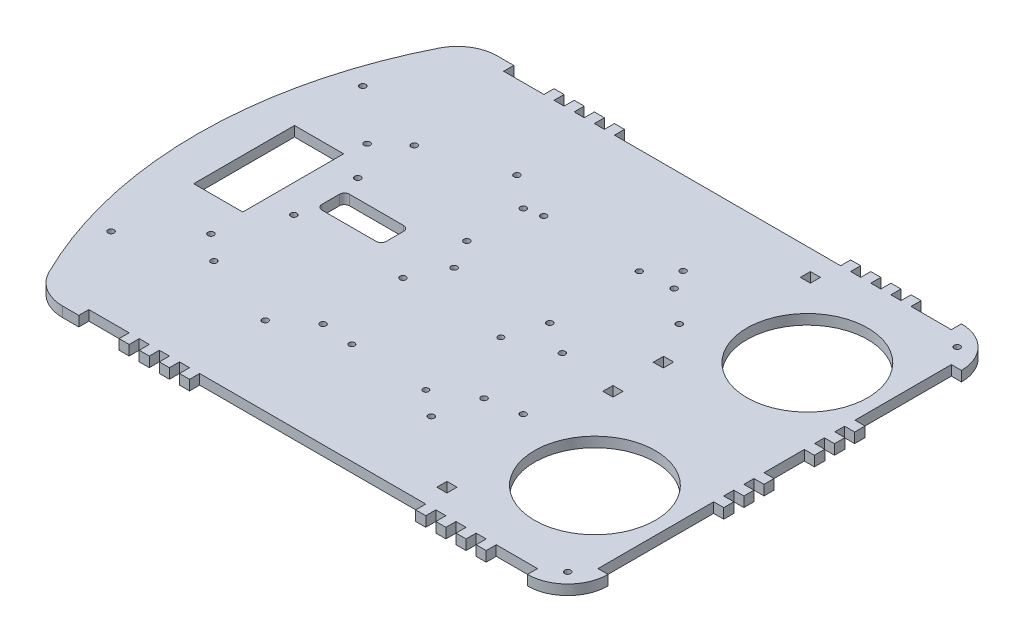
from build123d import *

# Parameters (mm, degrees)
MAIN_BASE_SKETCH_R   = 1.905
MAIN_BASE_SKETCH_R_2 = 1.796
MAIN_BASE_SKETCH_R_3 = 38.1
MAIN_BASE_SKETCH_W   = 6.302603838
MAIN_BASE_SKETCH_H   = 6.555527471
MAIN_BASE_SKETCH_W_2 = 6.35
MAIN_BASE_SKETCH_H_2 = 6.35
MAIN_BASE_SKETCH_W_3 = 30.959086934
MAIN_BASE_SKETCH_H_3 = 63.59667858
MAIN_BASE_DEPTH      = 6.35


with BuildPart() as part:
    # main_base_sketch → main_base (new body)
    with BuildSketch(Plane(origin=(0, 0, 0), x_dir=(1, 0, 0), z_dir=(0, 1, 0))):
        with BuildLine():
            Line((-94.961375831, 124.478458264), (-69.561375831, 124.478458264))
            Line((-69.561375831, 124.478458264), (-69.561375831, 130.828458264))
            Line((-69.561375831, 130.828458264), (-63.211375831, 130.828458264))
            Line((-63.211375831, 130.828458264), (-63.211375831, 124.478458264))
            Line((-63.211375831, 124.478458264), (-56.861375831, 124.478458264))
            Line((-56.861375831, 124.478458264), (-56.861375831, 130.828458264))
            Line((-56.861375831, 130.828458264), (-50.511375831, 130.828458264))
            Line((-50.511375831, 130.828458264), (-50.511375831, 124.478458264))
            Line((-50.511375831, 124.478458264), (-44.161375831, 124.478458264))
            Line((-44.161375831, 124.478458264), (-44.161375831, 130.828458264))
            Line((-44.161375831, 130.828458264), (-37.811375831, 130.828458264))
            Line((-37.811375831, 130.828458264), (-37.811375831, 124.478458264))
            Line((-37.811375831, 124.478458264), (-31.461375831, 124.478458264))
            Line((-31.461375831, 124.478458264), (-31.461375831, 130.828458264))
            Line((-31.461375831, 130.828458264), (-25.111375831, 130.828458264))
            Line((-25.111375831, 130.828458264), (-25.111375831, 124.478458264))
            Line((-25.111375831, 124.478458264), (117.475, 124.478458264))
            Line((117.475, 124.478458264), (117.475, 130.828458264))
            Line((117.475, 130.828458264), (123.825, 130.828458264))
            Line((123.825, 130.828458264), (123.825, 124.478458264))
            Line((123.825, 124.478458264), (130.175, 124.478458264))
            Line((130.175, 124.478458264), (130.175, 130.828458264))
            Line((130.175, 130.828458264), (136.525, 130.828458264))
            Line((136.525, 130.828458264), (136.525, 124.478458264))
            Line((136.525, 124.478458264), (142.875, 124.478458264))
            Line((142.875, 124.478458264), (142.875, 130.828458264))
            Line((142.875, 130.828458264), (149.225, 130.828458264))
            Line((149.225, 130.828458264), (149.225, 124.478458264))
            Line((149.225, 124.478458264), (155.575, 124.478458264))
            Line((155.575, 124.478458264), (155.575, 130.828458264))
            Line((155.575, 130.828458264), (161.925, 130.828458264))
            Line((161.925, 130.828458264), (161.925, 124.478458264))
            Line((161.925, 124.478458264), (187.325, 124.478458264))
            Line((187.325, 124.478458264), (187.325, 130.828458264))
            ThreePointArc((187.325, 130.828458264), (205.285512242, 123.388970506), (212.725, 105.428458264))
            Line((212.725, 105.428458264), (206.375, 105.428458264))
            Line((206.375, 105.428458264), (206.375, 44.655527471))
            Line((206.375, 44.655527471), (212.725, 44.655527471))
            Line((212.725, 44.655527471), (212.725, 38.1))
            Line((212.725, 38.1), (206.375, 38.1))
            Line((206.375, 38.1), (206.375, 31.955527471))
            Line((206.375, 31.955527471), (212.725, 31.955527471))
            Line((212.725, 31.955527471), (212.725, 25.4))
            Line((212.725, 25.4), (206.375, 25.4))
            Line((206.375, 25.4), (206.375, 24.179190074))
            Line((206.375, 24.179190074), (206.375, 19.255527471))
            Line((206.375, 19.255527471), (212.725, 19.255527471))
            Line((212.725, 19.255527471), (212.725, 12.7))
            Line((212.725, 12.7), (206.375, 12.7))
            Line((206.375, 12.7), (206.375, -12.7))
            Line((206.375, -12.7), (212.725, -12.7))
            Line((212.725, -12.7), (212.725, -19.05))
            Line((212.725, -19.05), (206.375, -19.05))
            Line((206.375, -19.05), (206.375, -25.4))
            Line((206.375, -25.4), (212.725, -25.4))
            Line((212.725, -25.4), (212.725, -31.75))
            Line((212.725, -31.75), (206.375, -31.75))
            Line((206.375, -31.75), (206.375, -38.1))
            Line((206.375, -38.1), (212.725, -38.1))
            Line((212.725, -38.1), (212.725, -44.45))
            Line((212.725, -44.45), (206.375, -44.45))
            Line((206.375, -44.45), (206.375, -117.410242597))
            Line((206.375, -117.410242597), (212.725, -117.410242597))
            ThreePointArc((212.725, -117.410242597), (205.285512242, -135.370754839), (187.325, -142.810242597))
            Line((187.325, -142.810242597), (187.325, -136.460242597))
            Line((187.325, -136.460242597), (161.284730748, -136.460242597))
            Line((161.284730748, -136.460242597), (161.284730748, -142.810242597))
            Line((161.284730748, -142.810242597), (154.934730748, -142.810242597))
            Line((154.934730748, -142.810242597), (154.934730748, -136.460242597))
            Line((154.934730748, -136.460242597), (148.584730748, -136.460242597))
            Line((148.584730748, -136.460242597), (148.584730748, -142.810242597))
            Line((148.584730748, -142.810242597), (142.234730748, -142.810242597))
            Line((142.234730748, -142.810242597), (142.234730748, -136.460242597))
            Line((142.234730748, -136.460242597), (135.884730748, -136.460242597))
            Line((135.884730748, -136.460242597), (135.884730748, -142.810242597))
            Line((135.884730748, -142.810242597), (129.534730748, -142.810242597))
            Line((129.534730748, -142.810242597), (129.534730748, -136.460242597))
            Line((129.534730748, -136.460242597), (123.184730748, -136.460242597))
            Line((123.184730748, -136.460242597), (123.184730748, -142.810242597))
            Line((123.184730748, -142.810242597), (116.834730748, -142.810242597))
            Line((116.834730748, -142.810242597), (116.834730748, -136.460242597))
            Line((116.834730748, -136.460242597), (-25.751645083, -136.460242597))
            Line((-25.751645083, -136.460242597), (-25.751645083, -142.810242597))
            Line((-25.751645083, -142.810242597), (-32.101645083, -142.810242597))
            Line((-32.101645083, -142.810242597), (-32.101645083, -136.460242597))
            Line((-32.101645083, -136.460242597), (-38.451645083, -136.460242597))
            Line((-38.451645083, -136.460242597), (-38.451645083, -142.810242597))
            Line((-38.451645083, -142.810242597), (-44.801645083, -142.810242597))
            Line((-44.801645083, -142.810242597), (-44.801645083, -136.460242597))
            Line((-44.801645083, -136.460242597), (-51.151645083, -136.460242597))
            Line((-51.151645083, -136.460242597), (-51.151645083, -142.810242597))
            Line((-51.151645083, -142.810242597), (-57.501645083, -142.810242597))
            Line((-57.501645083, -142.810242597), (-57.501645083, -136.460242597))
            Line((-57.501645083, -136.460242597), (-63.851645083, -136.460242597))
            Line((-63.851645083, -136.460242597), (-63.851645083, -142.810242597))
            Line((-63.851645083, -142.810242597), (-70.201645083, -142.810242597))
            Line((-70.201645083, -142.810242597), (-70.201645083, -136.460242597))
            Line((-70.201645083, -136.460242597), (-95.601645083, -136.460242597))
            Line((-95.601645083, -136.460242597), (-95.601645083, -142.810242597))
            Line((-95.601645083, -142.810242597), (-105.798207048, -142.810242597))
            ThreePointArc((-105.798207048, -142.810242597), (-119.167015715, -139.007347839), (-128.532661201, -128.737404395))
            ThreePointArc((-128.532661201, -128.737404395), (-157.286213724, -5.861503432), (-127.918775374, 116.869125935))
            ThreePointArc((-127.918775374, 116.869125935), (-118.556014486, 127.058910858), (-105.241228699, 130.828458264))
            Line((-105.241228699, 130.828458264), (-94.961375831, 130.828458264))
            Line((-94.961375831, 130.828458264), (-94.961375831, 124.478458264))
        make_face()
        with Locations((-82.6643, 55.745700743)):
            Circle(MAIN_BASE_SKETCH_R, mode=Mode.SUBTRACT)
        with Locations((-13.8303, 55.745700743)):
            Circle(MAIN_BASE_SKETCH_R, mode=Mode.SUBTRACT)
        with Locations((-3.2843, 57.993600743)):
            Circle(MAIN_BASE_SKETCH_R, mode=Mode.SUBTRACT)
        with Locations((-13.8303, 20.1549)):
            Circle(MAIN_BASE_SKETCH_R, mode=Mode.SUBTRACT)
        with Locations((-3.2843, 1.529400743)):
            Circle(MAIN_BASE_SKETCH_R, mode=Mode.SUBTRACT)
        with Locations((-82.6643, 20.1549)):
            Circle(MAIN_BASE_SKETCH_R, mode=Mode.SUBTRACT)
        with Locations((-82.6643, -20.1549)):
            Circle(MAIN_BASE_SKETCH_R, mode=Mode.SUBTRACT)
        with Locations((-13.8303, -20.1549)):
            Circle(MAIN_BASE_SKETCH_R, mode=Mode.SUBTRACT)
        with Locations((-82.6643, -70.568499257)):
            Circle(MAIN_BASE_SKETCH_R, mode=Mode.SUBTRACT)
        with Locations((-13.8303, -70.568499257)):
            Circle(MAIN_BASE_SKETCH_R, mode=Mode.SUBTRACT)
        with Locations((6.29, -72.547599257)):
            Circle(MAIN_BASE_SKETCH_R_2, mode=Mode.SUBTRACT)
        with Locations((54.55, -74.135099257)):
            Circle(MAIN_BASE_SKETCH_R_2, mode=Mode.SUBTRACT)
        with Locations((49.47, -21.747599257)):
            Circle(MAIN_BASE_SKETCH_R_2, mode=Mode.SUBTRACT)
        with Locations((57.0407, 1.529400743)):
            Circle(MAIN_BASE_SKETCH_R, mode=Mode.SUBTRACT)
        with Locations((57.0407, 57.993600743)):
            Circle(MAIN_BASE_SKETCH_R, mode=Mode.SUBTRACT)
        with Locations((-98.425, 41.822400743)):
            Circle(MAIN_BASE_SKETCH_R, mode=Mode.SUBTRACT)
        with Locations((-34.0871, 71.963600743)):
            Circle(MAIN_BASE_SKETCH_R, mode=Mode.SUBTRACT)
        with Locations((70.6863, 71.963600743)):
            Circle(MAIN_BASE_SKETCH_R, mode=Mode.SUBTRACT)
        with Locations((98.425, 41.822400743)):
            Circle(MAIN_BASE_SKETCH_R, mode=Mode.SUBTRACT)
        with Locations((98.425, -56.645199257)):
            Circle(MAIN_BASE_SKETCH_R, mode=Mode.SUBTRACT)
        with Locations((70.6863, -86.786399257)):
            Circle(MAIN_BASE_SKETCH_R, mode=Mode.SUBTRACT)
        with Locations((-34.0871, -86.786399257)):
            Circle(MAIN_BASE_SKETCH_R, mode=Mode.SUBTRACT)
        with Locations((-98.425, -56.645199257)):
            Circle(MAIN_BASE_SKETCH_R, mode=Mode.SUBTRACT)
        with Locations((77.47, -60.325)):
            Circle(MAIN_BASE_SKETCH_R, mode=Mode.SUBTRACT)
        with Locations((77.47, 59.53125)):
            Circle(MAIN_BASE_SKETCH_R, mode=Mode.SUBTRACT)
        with Locations((77.47, -10.95375)):
            Circle(MAIN_BASE_SKETCH_R, mode=Mode.SUBTRACT)
        with Locations((160.02, 60.978458264)):
            Circle(MAIN_BASE_SKETCH_R_3, mode=Mode.SUBTRACT)
        with Locations((160.02, -72.960242597)):
            Circle(MAIN_BASE_SKETCH_R_3, mode=Mode.SUBTRACT)
        with Locations((-131.296368682, 71.963600743)):
            Circle(MAIN_BASE_SKETCH_R, mode=Mode.SUBTRACT)
        with Locations((-131.296368682, -86.786399257)):
            Circle(MAIN_BASE_SKETCH_R, mode=Mode.SUBTRACT)
        with Locations((198.617679728, 116.869125935)):
            Circle(MAIN_BASE_SKETCH_R, mode=Mode.SUBTRACT)
        with Locations((198.617679728, -128.737404395)):
            Circle(MAIN_BASE_SKETCH_R, mode=Mode.SUBTRACT)
        with Locations((114.276301919, 15.977763736)):
            Rectangle(MAIN_BASE_SKETCH_W, MAIN_BASE_SKETCH_H, mode=Mode.SUBTRACT)
        with BuildLine():
            Line((-42.259046148, -8.681650359), (-76.408932816, -8.681650359))
            ThreePointArc((-76.408932816, -8.681650359), (-78.653996846, -7.751714389), (-79.583932816, -5.506650359))
            Line((-79.583932816, -5.506650359), (-79.583932816, 5.506650359))
            ThreePointArc((-79.583932816, 5.506650359), (-78.653996846, 7.751714389), (-76.408932816, 8.681650359))
            Line((-76.408932816, 8.681650359), (-42.259046148, 8.681650359))
            ThreePointArc((-42.259046148, 8.681650359), (-40.013982118, 7.751714389), (-39.084046148, 5.506650359))
            Line((-39.084046148, 5.506650359), (-39.084046148, -5.506650359))
            ThreePointArc((-39.084046148, -5.506650359), (-40.013982118, -7.751714389), (-42.259046148, -8.681650359))
        make_face(mode=Mode.SUBTRACT)
        with Locations((114.3, -15.875)):
            Rectangle(MAIN_BASE_SKETCH_W_2, MAIN_BASE_SKETCH_H_2, mode=Mode.SUBTRACT)
        with Locations((114.3, 108.603458264)):
            Rectangle(MAIN_BASE_SKETCH_W_2, MAIN_BASE_SKETCH_H_2, mode=Mode.SUBTRACT)
        with Locations((114.3, -120.585242597)):
            Rectangle(MAIN_BASE_SKETCH_W_2, MAIN_BASE_SKETCH_H_2, mode=Mode.SUBTRACT)
        with Locations((-115.816825215, -2.890758117)):
            Rectangle(MAIN_BASE_SKETCH_W_3, MAIN_BASE_SKETCH_H_3, mode=Mode.SUBTRACT)
    extrude(amount=MAIN_BASE_DEPTH)


solid = part.part
